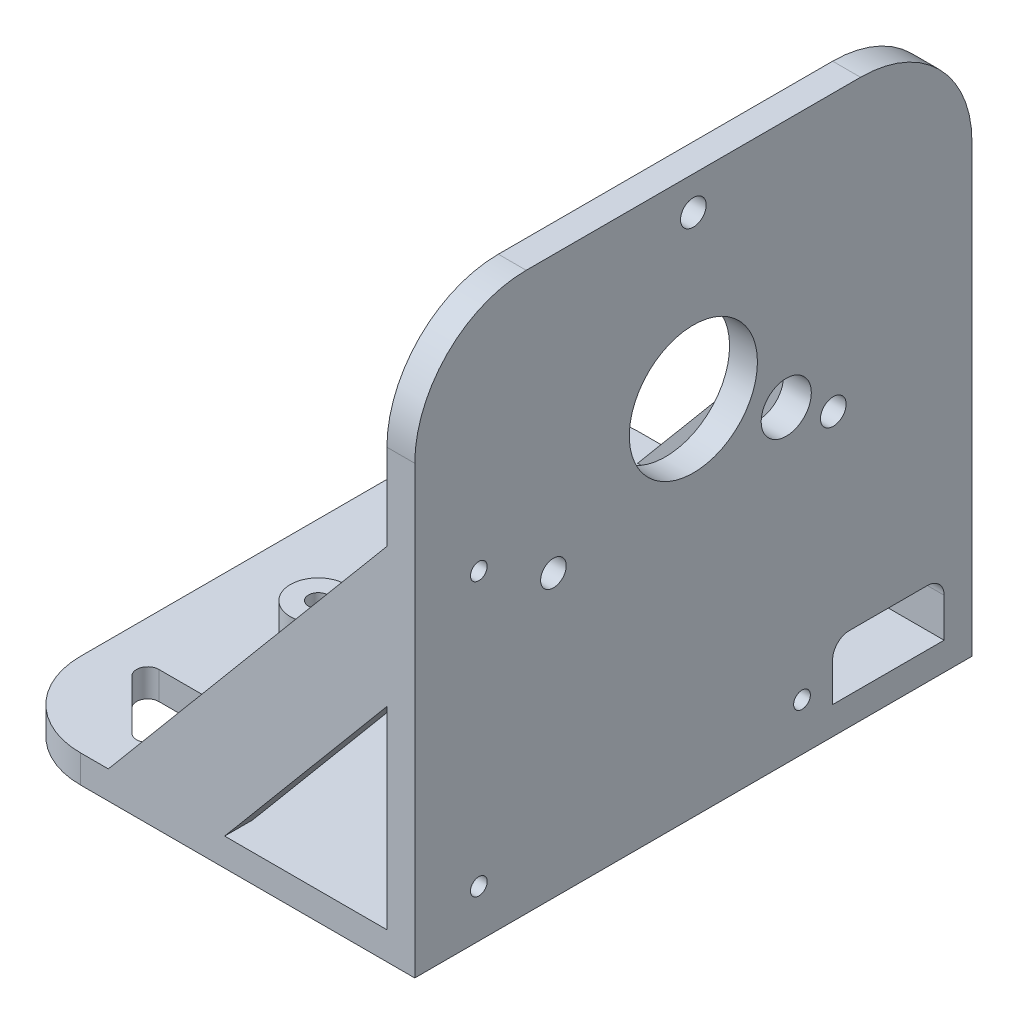
from build123d import *

# Parameters (mm, degrees)
SKETCH_1_W          = 70
SKETCH_1_H          = 70
EXTRUDE_1_DEPTH     = 5
HOLE_WIZARD_1_D     = 3.5
HOLE_WIZARD_2_D     = 23
SKETCH_7_W          = 70
SKETCH_7_H          = 100
EXTRUDE_2_DEPTH     = 5
HOLE_WIZARD_4_D     = 4.6
HOLE_WIZARD_5_D     = 23
SKETCH_16_R         = 5
SKETCH_16_R_2       = 1.75
EXTRUDE_3_DEPTH     = 5
SKETCH_17_W         = 5
SKETCH_17_H         = 60
SKETCH_17_W_2       = 35
SKETCH_17_H_2       = 5
EXTRUDE_4_DEPTH     = 15
SKETCH_18_W         = 35
SKETCH_18_H         = 5
SKETCH_18_W_2       = 5
SKETCH_18_H_2       = 60
EXTRUDE_5_DEPTH     = 15
EXTRUDE_6_DEPTH     = 5
EXTRUDE_7_DEPTH     = 5
HOLE_WIZARD_6_D     = 3
HOLE_WIZARD_6_DEPTH = 5
FILLET_2_R          = 20
HOLE_WIZARD_7_D     = 9
CUT_EXTRUDE_1_DEPTH = 10
FILLET_3_R          = 2
FILLET_4_R          = 15
SKETCH_29_W         = 20
SKETCH_29_H         = 10
CUT_EXTRUDE_2_DEPTH = 10
FILLET_5_R          = 3
HOLE_WIZARD_8_D     = 3.3
CUT_EXTRUDE_3_REACH = 148.969


with BuildPart() as part:
    # 草图1 → 凸台-拉伸1 (new body)
    with BuildSketch(Plane(origin=(0, 0, 0), x_dir=(1, 0, 0), z_dir=(0, 1, 0))):
        Rectangle(SKETCH_1_W, SKETCH_1_H)
    extrude(amount=EXTRUDE_1_DEPTH)

    # 孔1 (through all)
    with Locations(Plane(origin=(0, 5, 0), x_dir=(1, 0, 0), z_dir=(0, 1, 0))):
        with Locations((0, 20), (-17.320508076, -10), (17.320508076, -10)):
            Hole(HOLE_WIZARD_1_D / 2)

    # 孔2 (through all)
    with Locations(Plane(origin=(0, 5, 0), x_dir=(1, 0, 0), z_dir=(0, 1, 0))):
        with Locations((0, 0)):
            Hole(HOLE_WIZARD_2_D / 2)

    # 草图7 → 凸台-拉伸2 (add)
    with BuildSketch(Plane(origin=(35, 0, 0), x_dir=(0, 0, -1), z_dir=(1, 0, 0))):
        with Locations((0, 50)):
            Rectangle(SKETCH_7_W, SKETCH_7_H)
    extrude(amount=EXTRUDE_2_DEPTH)

    # 孔4 (through all)
    with Locations(Plane(origin=(40, 0, 0), x_dir=(0, 0, -1), z_dir=(1, 0, 0))):
        with Locations((0, 94), (-25.11473671, 50.5), (25.11473671, 50.5)):
            Hole(HOLE_WIZARD_4_D / 2)

    # 孔5 (through all)
    with Locations(Plane(origin=(40, 0, 0), x_dir=(0, 0, -1), z_dir=(1, 0, 0))):
        with Locations((0, 65)):
            Hole(HOLE_WIZARD_5_D / 2)

    # 草图16 → 凸台-拉伸3 (add)
    # profile 1 of 3: a face of its own
    with BuildSketch(Plane(origin=(0, 5, 0), x_dir=(1, 0, 0), z_dir=(0, 1, 0))):
        with Locations(Location((0, 20, 0), (0, 0, 90))):
            Circle(SKETCH_16_R)
        with Locations(Location((0, 20, 0), (0, 0, 270))):
            Circle(SKETCH_16_R_2, mode=Mode.SUBTRACT)
    # profile 2 of 3: a face of its own
    with BuildSketch(Plane(origin=(0, 5, 0), x_dir=(1, 0, 0), z_dir=(0, 1, 0))):
        with Locations(Location((-17.320508076, -10, 0), (0, 0, 90))):
            Circle(SKETCH_16_R)
        with Locations(Location((-17.320508076, -10, 0), (0, 0, 270))):
            Circle(SKETCH_16_R_2, mode=Mode.SUBTRACT)
    # profile 3 of 3: a face of its own
    with BuildSketch(Plane(origin=(0, 5, 0), x_dir=(1, 0, 0), z_dir=(0, 1, 0))):
        with Locations(Location((17.320508076, -10, 0), (0, 0, 90))):
            Circle(SKETCH_16_R)
        with Locations(Location((17.320508076, -10, 0), (0, 0, 270))):
            Circle(SKETCH_16_R_2, mode=Mode.SUBTRACT)
    extrude(amount=EXTRUDE_3_DEPTH)

    # 草图17 → 凸台-拉伸4 (add)
    with BuildSketch(Plane(origin=(0, 0, -35), x_dir=(-1, 0, 0), z_dir=(0, 0, -1))):
        with Locations((-37.5, 70)):
            Rectangle(SKETCH_17_W, SKETCH_17_H)
        Polygon((-35, 35), (-40, 40), (-40, 0), (0, 0), (-5, 5), (-35, 5), align=None)
        Polygon((-35, 40), (-40, 40), (-35, 35), align=None)
        with Locations((17.5, 2.5)):
            Rectangle(SKETCH_17_W_2, SKETCH_17_H_2)
        Polygon((0, 5), (-5, 5), (0, 0), align=None)
    extrude(amount=EXTRUDE_4_DEPTH)

    # 草图18 → 凸台-拉伸5 (add)
    with BuildSketch(Plane.XY.offset(35)):
        with Locations((-17.5, 2.5)):
            Rectangle(SKETCH_18_W, SKETCH_18_H)
        Polygon((0, 0), (5, 5), (0, 5), align=None)
        Polygon((40, 0), (40, 40), (35, 35), (35, 5), (5, 5), (0, 0), align=None)
        Polygon((35, 35), (40, 40), (35, 40), align=None)
        with Locations((37.5, 70)):
            Rectangle(SKETCH_18_W_2, SKETCH_18_H_2)
    extrude(amount=EXTRUDE_5_DEPTH)

    # 草图19 → 凸台-拉伸6 (add)
    with BuildSketch(Plane(origin=(0, 0, -50), x_dir=(-1, 0, 0), z_dir=(0, 0, -1))):
        Polygon((15, 5), (-35, 64.58767963), (-35, 5), align=None)
    extrude(amount=-EXTRUDE_6_DEPTH)

    # 草图20 → 凸台-拉伸7 (add)
    with BuildSketch(Plane.XY.offset(50)):
        Polygon((-15, 5), (35, 64.58767963), (35, 5), align=None)
    extrude(amount=-EXTRUDE_7_DEPTH)

    # 孔6
    with Locations(Plane(origin=(40, 0, 0), x_dir=(0, 0, -1), z_dir=(1, 0, 0))):
        with Locations((-38.5, 57.5), (-38.5, 8.5), (19.5, 8.5)):
            Hole(HOLE_WIZARD_6_D / 2, depth=HOLE_WIZARD_6_DEPTH)

    # 圆角2
    # the kernel refuses this fillet: 20 mm, written as the material it takes off along each edge
    with BuildSketch(Plane(origin=(-15, 100, -50), x_dir=(0, -1, 0), z_dir=(1, 0, 0)), Plane(origin=(90, 100, 50), x_dir=(0, -1, 0), z_dir=(-1, 0, 0))) as fillet_2_piece_1:
        with BuildLine():
            CenterArc((FILLET_2_R, -FILLET_2_R), FILLET_2_R, 90, 90)
            Line((0, -FILLET_2_R), (0, 0))
            Line((0, 0), (FILLET_2_R, 0))
        make_face()
    extrude(amount=105, mode=Mode.SUBTRACT)

    # 孔7 (through all)
    with Locations(Plane.ZY.offset(-35)):
        with Locations((-16.670989023, 55.375)):
            Hole(HOLE_WIZARD_7_D / 2)

    # 草图28 → 切除-拉伸1 (cut)
    with BuildSketch(Plane(origin=(0, 5, 0), x_dir=(1, 0, 0), z_dir=(0, 1, 0))):
        Polygon((-15, 45.757359313), (-30.757359313, 30), (-15, 30), align=None)
        Polygon((-30.757359313, -30), (-15, -45.757359313), (-15, -30), align=None)
    extrude(amount=-CUT_EXTRUDE_1_DEPTH, mode=Mode.SUBTRACT)

    # 圆角3
    # the kernel refuses this fillet: 2 mm, written as the material it adds along each edge
    with BuildSketch(Plane(origin=(-30.757359313, 5, -30), x_dir=(0.7071067811865478, 0, -0.7071067811865471), z_dir=(0, -1, 0)), Plane(origin=(-15, 5, 45.757359313), x_dir=(-0.7071067811865471, 0, -0.7071067811865479), z_dir=(0, -1, 0))) as fillet_3_piece_1:
        with BuildLine():
            CenterArc((FILLET_3_R * 2.41421356237, FILLET_3_R), FILLET_3_R, 135, 135)
            Line((FILLET_3_R * 1.70710678119, FILLET_3_R * 1.70710678119), (0, 0))
            Line((0, 0), (FILLET_3_R * 2.41421356237, 0))
        make_face()
    extrude(amount=5)
    with BuildSketch(Plane(origin=(-15, 5, -45.757359313), x_dir=(-0.7071067811865478, 0, 0.7071067811865474), z_dir=(0, -1, 0)), Plane(origin=(-30.757359313, 5, 30), x_dir=(0.7071067811865476, 0, 0.7071067811865476), z_dir=(0, -1, 0))) as fillet_3_piece_2:
        with BuildLine():
            CenterArc((FILLET_3_R * 2.41421356237, -FILLET_3_R), FILLET_3_R, 90, 135)
            Line((FILLET_3_R * 1.70710678119, -FILLET_3_R * 1.70710678119), (0, 0))
            Line((0, 0), (FILLET_3_R * 2.41421356237, 0))
        make_face()
    extrude(amount=5)
    with BuildSketch(Plane(origin=(-15, 5, -30), x_dir=(-1, 0, 0), z_dir=(0, -1, 0)), Plane(origin=(-15, 5, 30), x_dir=(0, 0, 1), z_dir=(0, -1, 0))) as fillet_3_piece_3:
        with BuildLine():
            CenterArc((FILLET_3_R, FILLET_3_R), FILLET_3_R, 180, 90)
            Line((0, FILLET_3_R), (0, 0))
            Line((0, 0), (FILLET_3_R, 0))
        make_face()
    extrude(amount=5)

    # 圆角4
    fillet_4_edges = [part.edges().sort_by_distance(p)[0] for p in [
        (-35, 2.5, -50),
        (-35, 2.5, 50),
    ]]
    fillet(fillet_4_edges, radius=FILLET_4_R)

    # 草图29 → 切除-拉伸2 (cut)
    with BuildSketch(Plane(origin=(40, 0, 0), x_dir=(0, 0, -1), z_dir=(1, 0, 0))):
        with Locations((35, 10)):
            Rectangle(SKETCH_29_W, SKETCH_29_H)
    extrude(amount=-CUT_EXTRUDE_2_DEPTH, mode=Mode.SUBTRACT)

    # 圆角5
    fillet_5_edges = [part.edges().sort_by_distance(p)[0] for p in [
        (37.5, 15, -45),
        (37.5, 15, -25),
    ]]
    fillet(fillet_5_edges, radius=FILLET_5_R)

    # 孔8 (through all)
    with Locations(Plane(origin=(0, 5, 0), x_dir=(1, 0, 0), z_dir=(0, 1, 0))):
        with Locations((-31.363961031, 37.878679656), (-27.121320344, 42.121320344), (-22.878679656, 46.363961031)):
            Hole(HOLE_WIZARD_8_D / 2)

    # 草图34 → 切除-拉伸3 (cut, up to next)
    with BuildSketch(Plane.XY.offset(50), mode=Mode.PRIVATE) as cut_extrude_3_sk1:
        Polygon((35, 5), (35, 39.6960984), (5.886516629, 5), align=None)
    cut_extrude_3_tool1 = extrude(cut_extrude_3_sk1.sketch, amount=-CUT_EXTRUDE_3_REACH, mode=Mode.PRIVATE) & part.part
    add(cut_extrude_3_tool1.solids().sort_by_distance((25.295506, 16.565366, 50))[0], mode=Mode.SUBTRACT)


solid = part.part
